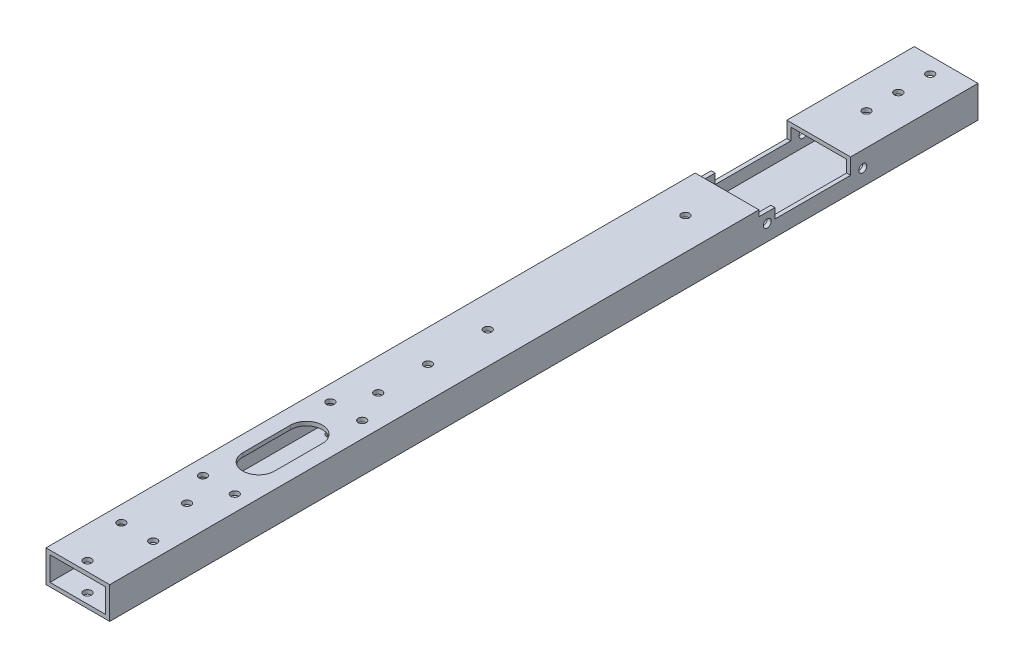
from build123d import *

# Parameters (mm, degrees)
SKETCH1_W           = 50.8
SKETCH1_H           = 25.4
SKETCH1_W_2         = 44.45
SKETCH1_H_2         = 19.05
BOSS_EXTRUDE1_DEPTH = 692.15
SKETCH2_W           = 60.325
SKETCH2_H           = 12.7
CUT_EXTRUDE1_DEPTH  = 695.127907882
SKETCH3_R           = 3.175
CUT_EXTRUDE2_DEPTH  = 695.127907882
SKETCH4_W           = 12.7
SKETCH4_H           = 4.7625
CUT_EXTRUDE3_DEPTH  = 695.127907882
SKETCH5_R           = 3.175
SKETCH5_R_2         = 2.0828
CUT_EXTRUDE4_DEPTH  = 694.081483305
CUT_EXTRUDE5_DEPTH  = 3.175
SKETCH8_R           = 3.175
CUT_EXTRUDE6_DEPTH  = 694.081483305


with BuildPart() as part:
    # Sketch1 → Boss-Extrude1 (new body)
    with BuildSketch(Plane.XY):
        Rectangle(SKETCH1_W, SKETCH1_H)
        Rectangle(SKETCH1_W_2, SKETCH1_H_2, mode=Mode.SUBTRACT)
    extrude(amount=BOSS_EXTRUDE1_DEPTH)

    # Sketch2 → Cut-Extrude1 (cut, through all)
    with BuildSketch(Plane(origin=(25.4, 0, 0), x_dir=(0, 0, -1), z_dir=(1, 0, 0))):
        with Locations((-131.7625, 6.35)):
            Rectangle(SKETCH2_W, SKETCH2_H)
    extrude(amount=-CUT_EXTRUDE1_DEPTH, mode=Mode.SUBTRACT)

    # Sketch3 → Cut-Extrude2 (cut, through all)
    with BuildSketch(Plane(origin=(25.4, 0, 0), x_dir=(0, 0, -1), z_dir=(1, 0, 0))):
        with Locations((-167.999918, 0)):
            Circle(SKETCH3_R)
        with Locations((-91.813888, 0)):
            Circle(SKETCH3_R)
    extrude(amount=-CUT_EXTRUDE2_DEPTH, mode=Mode.SUBTRACT)

    # Sketch4 → Cut-Extrude3 (cut, through all)
    with BuildSketch(Plane(origin=(25.4, 0, 0), x_dir=(0, 0, -1), z_dir=(1, 0, 0))):
        with Locations((-168.275, 10.31875)):
            Rectangle(SKETCH4_W, SKETCH4_H)
    extrude(amount=-CUT_EXTRUDE3_DEPTH, mode=Mode.SUBTRACT)

    # Sketch5 → Cut-Extrude4 (cut, through all)
    with BuildSketch(Plane(origin=(0, 12.7, 0), x_dir=(1, 0, 0), z_dir=(0, 1, 0))):
        with Locations((0, -207.85963)):
            Circle(SKETCH5_R)
        with Locations((0, -365.440722)):
            Circle(SKETCH5_R)
        with Locations((0, -413.111442)):
            Circle(SKETCH5_R)
        with Locations((0, -452.759064)):
            Circle(SKETCH5_R)
        with Locations((-12.7, -478.159064)):
            Circle(SKETCH5_R)
        with Locations((12.7, -478.159064)):
            Circle(SKETCH5_R)
        with Locations((-12.7, -579.759064)):
            Circle(SKETCH5_R)
        with Locations((12.7, -579.759064)):
            Circle(SKETCH5_R)
        with Locations((0, -605.159064)):
            Circle(SKETCH5_R)
        with Locations((-12.7, -644.806686)):
            Circle(SKETCH5_R)
        with Locations((12.7, -644.806686)):
            Circle(SKETCH5_R)
        with Locations((0, -684.454308)):
            Circle(SKETCH5_R)
        with Locations((0, -548.009064)):
            Circle(SKETCH5_R_2)
        with Locations((0, -535.309064)):
            Circle(SKETCH5_R_2)
        with Locations((0, -522.609064)):
            Circle(SKETCH5_R_2)
        with Locations((0, -509.909064)):
            Circle(SKETCH5_R_2)
    extrude(amount=-CUT_EXTRUDE4_DEPTH, mode=Mode.SUBTRACT)

    # Sketch7 → Cut-Extrude5 (cut)
    with BuildSketch(Plane(origin=(0, 12.7, 0), x_dir=(1, 0, 0), z_dir=(0, 1, 0))):
        with BuildLine():
            Line((-12.7, -548.009064), (-12.7, -509.909064))
            ThreePointArc((-12.7, -509.909064), (0, -497.209064), (12.7, -509.909064))
            Line((12.7, -509.909064), (12.7, -548.009064))
            ThreePointArc((12.7, -548.009064), (0, -560.709064), (-12.7, -548.009064))
        make_face()
    extrude(amount=-CUT_EXTRUDE5_DEPTH, mode=Mode.SUBTRACT)

    # Sketch8 → Cut-Extrude6 (cut, through all)
    with BuildSketch(Plane(origin=(0, 12.7, 0), x_dir=(1, 0, 0), z_dir=(0, 1, 0))):
        with Locations((0, -12.7)):
            Circle(SKETCH8_R)
        with Locations((0, -38.1)):
            Circle(SKETCH8_R)
        with Locations((0, -63.5)):
            Circle(SKETCH8_R)
    extrude(amount=-CUT_EXTRUDE6_DEPTH, mode=Mode.SUBTRACT)


solid = part.part
